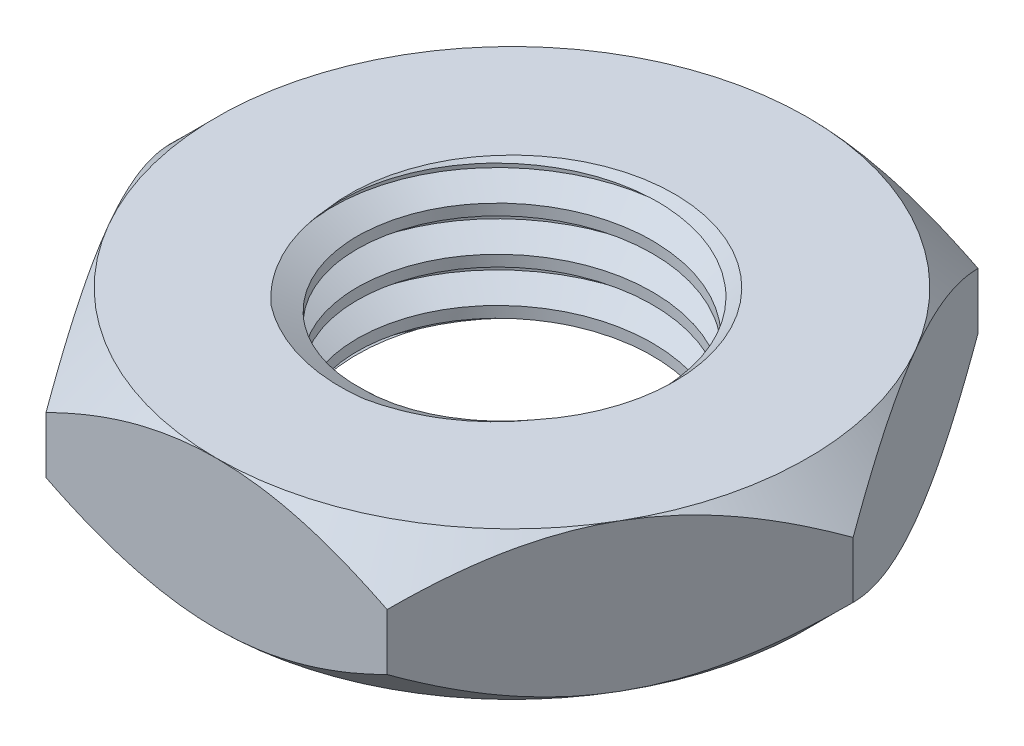
from build123d import *

# Parameters (mm, degrees)
BOSS_EXTRUDE1_DEPTH     = 2.5
SKETCH2_OUTSIDE_W       = 65.43
SKETCH2_OUTSIDE_H       = 62.336
SKETCH2_OUTSIDE_R       = 10
CUT_EXTRUDE1_DEPTH      = 17.072751268
CUT_EXTRUDE1_DRAFT      = -45
MIRROR1_COPY_1_SKETCH_W = 65.43
MIRROR1_COPY_1_SKETCH_H = 62.336
MIRROR1_COPY_1_SKETCH_R = 10
MIRROR1_COPY_1_DEPTH    = 17.072751268
MIRROR1_COPY_1_DRAFT    = -45
SKETCH3_R               = 5
CUT_EXTRUDE2_DEPTH      = 17.072751268
CHAMFER1_SIZE           = 0.5
THREAD1_PITCH           = 1.5


with BuildPart() as part:
    # Sketch1 → Boss-Extrude1 (new, symmetric)
    with BuildSketch(Plane(origin=(0, 0, 0), x_dir=(1, 0, 0), z_dir=(0, 1, 0))):
        Polygon((-5.773502692, -10), (5.773502692, -10), (11.547005384, 0), (5.773502692, 10), (-5.773502692, 10), (-11.547005384, 0), align=None)
    extrude(amount=BOSS_EXTRUDE1_DEPTH, both=True)


with BuildPart() as cut_extrude1_tool:
    # Sketch2 outside → Cut-Extrude1 (with draft: the straight prism first)
    with BuildSketch(Plane(origin=(0, 2.5, 0), x_dir=(1, 0, 0), z_dir=(0, 1, 0))):
        Rectangle(SKETCH2_OUTSIDE_W, SKETCH2_OUTSIDE_H)
        Circle(SKETCH2_OUTSIDE_R, mode=Mode.SUBTRACT)
    extrude(amount=-CUT_EXTRUDE1_DEPTH)
    # Cut-Extrude1: the draft: its side faces are tilted about the plane it starts from
    cut_extrude1_sides = [cut_extrude1_tool.faces().sort_by_distance(p)[0] for p in [
        (0, -6.036375634, 31.168),
        (32.715, -6.036375634, 0),
        (0, -6.036375634, -31.168),
        (-32.715, -6.036375634, 0),
        (-10, -6.036375634, 0),
    ]]
    draft(cut_extrude1_sides, Plane(origin=(0, 2.5, 0), x_dir=(1, 0, 0), z_dir=(0, 1, 0)), CUT_EXTRUDE1_DRAFT)


with BuildPart() as part_1:
    add(part.part)

    # Cut-Extrude1: cut by cut_extrude1_tool
    add(cut_extrude1_tool.part, mode=Mode.SUBTRACT)


with BuildPart() as mirror1_copy_1_tool:
    # Mirror1 copy 1 sketch → Mirror1 copy 1 (with draft: the straight prism first)
    with BuildSketch(Plane.XZ.offset(2.5)):
        Rectangle(MIRROR1_COPY_1_SKETCH_W, MIRROR1_COPY_1_SKETCH_H)
        Circle(MIRROR1_COPY_1_SKETCH_R, mode=Mode.SUBTRACT)
    extrude(amount=-MIRROR1_COPY_1_DEPTH)
    # Mirror1 copy 1: the draft: its side faces are tilted about the plane it starts from
    mirror1_copy_1_sides = [mirror1_copy_1_tool.faces().sort_by_distance(p)[0] for p in [
        (0, 6.036375634, 31.168),
        (32.715, 6.036375634, 0),
        (0, 6.036375634, -31.168),
        (-32.715, 6.036375634, 0),
        (-10, 6.036375634, 0),
    ]]
    draft(mirror1_copy_1_sides, Plane.XZ.offset(2.5), MIRROR1_COPY_1_DRAFT)


with BuildPart() as part_2:
    add(part_1.part)

    # Mirror1 copy 1: cut by mirror1_copy_1_tool
    add(mirror1_copy_1_tool.part, mode=Mode.SUBTRACT)

    # Sketch3 → Cut-Extrude2 (cut, through all)
    with BuildSketch(Plane(origin=(0, 2.5, 0), x_dir=(1, 0, 0), z_dir=(0, 1, 0))):
        with Locations(Location((0, 0, 0), (0, 0, 270))):
            Circle(SKETCH3_R)
    extrude(amount=-CUT_EXTRUDE2_DEPTH, mode=Mode.SUBTRACT)

    # Chamfer1
    chamfer1_edges = [part_2.edges().sort_by_distance(p)[0] for p in [
        (0, 2.5, -5),
    ]]
    chamfer(chamfer1_edges, length=CHAMFER1_SIZE)

    # Thread1: the profile of Thread Profile1 profile screwed along a right-hand helix of 4.333333 turns, 8 arcs to a turn; built about Z, then put on its axis
    thread1_z = Axis((0, 0, 0), (0, 0, 1))
    thread1_corners = [(4.9997, -1e-09, -0.000173205), (5.811898813, -1e-09, 0.468749998), (5.811898813, -1e-09, 0.656249998), (4.9997, -1e-09, 1.125173201)]
    with BuildLine(mode=Mode.PRIVATE) as thread1_profile:
        Line(thread1_corners[0], thread1_corners[1])
        Line(thread1_corners[1], thread1_corners[2])
        Line(thread1_corners[2], thread1_corners[3])
        Line(thread1_corners[3], thread1_corners[0])
    thread1_cap = Face(thread1_profile.wire())
    thread1_turn_angles = [0, 22.5, 45, 67.5, 90, 112.5, 135, 157.5, 180, 202.5, 225, 247.5, 270, 292.5, 315, 337.5, 360]
    thread1_turn_weights = [1, 0.9238795325112867, 1, 0.9238795325112867, 1, 0.9238795325112867, 1, 0.9238795325112867, 1, 0.9238795325112867, 1, 0.9238795325112867, 1, 0.9238795325112867, 1, 0.9238795325112867, 1]
    thread1_turn_rails = [Edge.make_bspline([Vector(p[0], p[1], 0).rotate(thread1_z, thread1_turn_angles[k]) / thread1_turn_weights[k] + Vector(0, 0, p[2] + THREAD1_PITCH * thread1_turn_angles[k] / 360) for k in range(17)], [0, 0, 0, 1, 1, 2, 2, 3, 3, 4, 4, 5, 5, 6, 6, 7, 7, 8, 8, 8], 2, thread1_turn_weights) for p in thread1_corners]
    thread1_turn_sides = [Face.make_surface_from_curves(thread1_turn_rails[p[0]], thread1_turn_rails[p[1]]) for p in [(0, 1), (1, 2), (2, 3), (3, 0)]]
    thread1_last_angles = [1440, 1462.5, 1485, 1507.5, 1530, 1545, 1560]
    thread1_last_weights = [1, 0.9238795325112867, 1, 0.9238795325112867, 1, 0.9659258262890693, 1]
    thread1_last_rails = [Edge.make_bspline([Vector(p[0], p[1], 0).rotate(thread1_z, thread1_last_angles[k]) / thread1_last_weights[k] + Vector(0, 0, p[2] + THREAD1_PITCH * thread1_last_angles[k] / 360) for k in range(7)], [0, 0, 0, 1, 1, 2, 2, 3, 3, 3], 2, thread1_last_weights) for p in thread1_corners]
    thread1_last_sides = [Face.make_surface_from_curves(thread1_last_rails[p[0]], thread1_last_rails[p[1]]) for p in [(0, 1), (1, 2), (2, 3), (3, 0)]]
    thread1 = Plane(origin=(0, 4, 0), x_dir=(-0.5, 0, -0.866025404), z_dir=(0, -1, 0)) * Solid(Shell([*[p.moved(Location((0, 0, THREAD1_PITCH * i))) for i in range(4) for p in thread1_turn_sides], *thread1_last_sides, thread1_cap, thread1_cap.rotate(thread1_z, 1560).moved(Location((0, 0, THREAD1_PITCH * 1560 / 360)))]))
    add(thread1, mode=Mode.SUBTRACT)


solid = part_2.part
